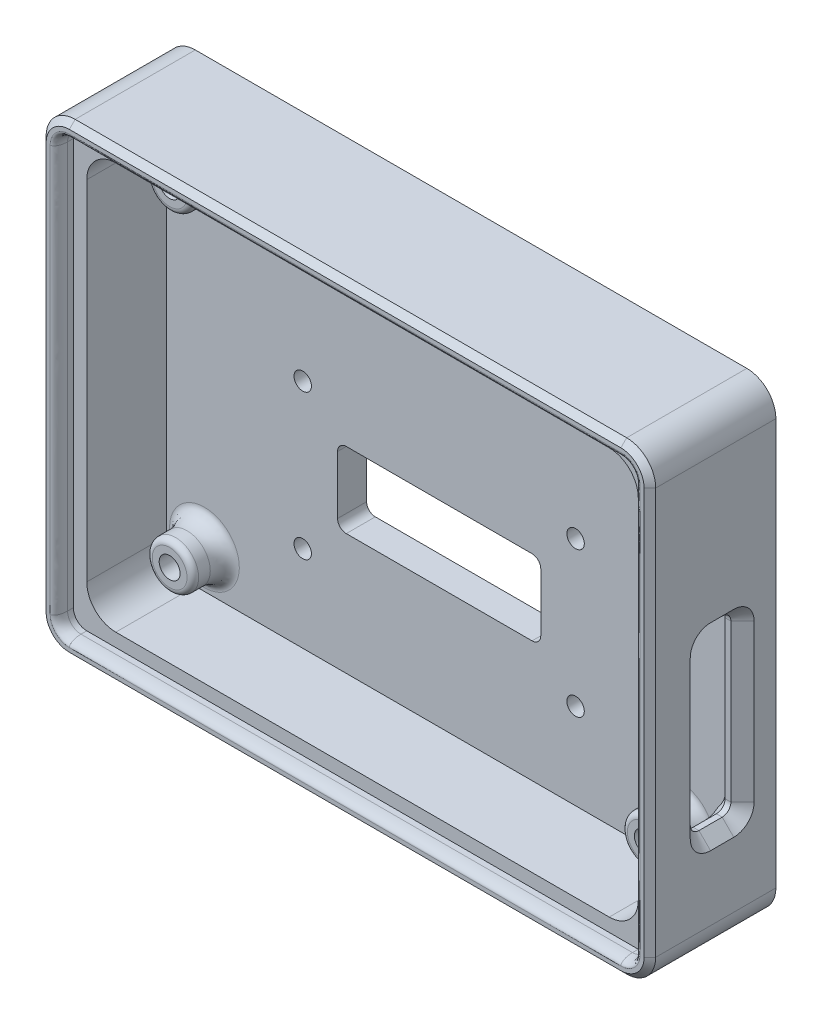
from build123d import *
from build123d.topology import SkipClean

# Parameters (mm, degrees)
SZKIC1_W                       = 105
SZKIC1_H                       = 80
DODANIE_WYCI_GNI_CIE1_DEPTH    = 21.7
SKORUPA2_T                     = -5
OTW_R_GWINTOWANY_M3X0_51_D     = 2.5
OTW_R_GWINTOWANY_M3X0_51_DEPTH = 6
OTW_R_GWINTOWANY_M3X0_51_TIP   = 0.751075774
SZKIC7_W                       = 35
SZKIC7_H                       = 13
WYTNIJ_WYCI_GNI_CIE1_DEPTH     = 69.081862489
ZAOKR_GLENIE1_R                = 5
WYTNIJ_WYCI_GNI_CIE2_DEPTH     = 5
WYTNIJ_WYCI_GNI_CIE5_DEPTH     = 3
SFAZOWANIE1_SIZE               = 2
ZAOKR_GLENIE2_R                = 1.5
SZKIC14_R                      = 4
SZKIC14_R_2                    = 1.25
DODANIE_WYCI_GNI_CIE2_DEPTH    = 6
ZAOKR_GLENIE3_R                = 1
ZAOKR_GLENIE4_SIZE             = 2
ZAOKR_GLENIE4_SIZE_2           = 1
SFAZOWANIE2_SIZE               = 1
SZKIC16_R                      = 1.8
WYTNIJ_WYCI_GNI_CIE6_DEPTH     = 70.477622328
SZKIC17_R                      = 3.5
SZKIC17_R_2                    = 3.8
WYTNIJ_WYCI_GNI_CIE7_DEPTH     = 3.5
ZAOKR_GLENIE5_SIZE             = 2
ZAOKR_GLENIE5_SIZE_2           = 3
SZKIC20_R                      = 1.5
WYTNIJ_WYCI_GNI_CIE8_DEPTH     = 69.081862514


with BuildPart() as part:
    # Szkic1 → Dodanie-wyciągnięcie1 (new body)
    with BuildSketch(Plane.XY):
        Rectangle(SZKIC1_W, SZKIC1_H)
    extrude(amount=DODANIE_WYCI_GNI_CIE1_DEPTH)

    # Skorupa2
    skorupa2_openings = [part.faces().sort_by_distance(p)[0] for p in [
        (0, 0, 21.7),
    ]]
    offset(amount=SKORUPA2_T, openings=skorupa2_openings, kind=Kind.INTERSECTION)

    # Otwór gwintowany M3x0.51
    with Locations(Plane.XY.offset(5)):
        with Locations((-40.925, 28.425), (40.925, 28.425), (40.925, -28.425), (-40.925, -28.425)):
            Hole(OTW_R_GWINTOWANY_M3X0_51_D / 2, depth=OTW_R_GWINTOWANY_M3X0_51_DEPTH)
            with Locations((0, 0, -(OTW_R_GWINTOWANY_M3X0_51_DEPTH + OTW_R_GWINTOWANY_M3X0_51_TIP / 2))):  # 118° drill point
                Cone(0, OTW_R_GWINTOWANY_M3X0_51_D / 2, OTW_R_GWINTOWANY_M3X0_51_TIP, mode=Mode.SUBTRACT)

    # Szkic7 → Wytnij-wyciągnięcie1 (cut, through all)
    with BuildSketch(Plane.XY.offset(5)):
        with Locations((-0.5, -7.645)):
            Rectangle(SZKIC7_W, SZKIC7_H)
    extrude(amount=-WYTNIJ_WYCI_GNI_CIE1_DEPTH, mode=Mode.SUBTRACT)

    # Zaokrąglenie1
    zaokr_glenie1_edges = [part.edges().sort_by_distance(p)[0] for p in [
        (47.5, -35, 13.35),
        (47.5, 35, 13.35),
        (-47.5, 35, 13.35),
        (-47.5, -35, 13.35),
        (52.5, -40, 10.85),
        (-52.5, -40, 10.85),
        (-52.5, 40, 10.85),
        (52.5, 40, 10.85),
    ]]
    fillet(zaokr_glenie1_edges, radius=ZAOKR_GLENIE1_R)

    # Szkic8 → Wytnij-wyciągnięcie2 (cut)
    with BuildSketch(Plane(origin=(52.5, 0, 0), x_dir=(0, 0, -1), z_dir=(1, 0, 0))):
        with BuildLine():
            Line((-11.25, -21.82), (-7.25, -21.82))
            ThreePointArc((-7.25, -21.82), (-6.189339828, -21.380660172), (-5.75, -20.32))
            Line((-5.75, -20.32), (-5.75, 6.68))
            ThreePointArc((-5.75, 6.68), (-6.189339828, 7.740660172), (-7.25, 8.18))
            Line((-7.25, 8.18), (-11.25, 8.18))
            ThreePointArc((-11.25, 8.18), (-12.310660172, 7.740660172), (-12.75, 6.68))
            Line((-12.75, 6.68), (-12.75, -20.32))
            ThreePointArc((-12.75, -20.32), (-12.310660172, -21.380660172), (-11.25, -21.82))
        make_face()
    extrude(amount=-WYTNIJ_WYCI_GNI_CIE2_DEPTH, mode=Mode.SUBTRACT)

    # Szkic13 → Wytnij-wyciągnięcie5 (cut)
    with BuildSketch(Plane.XY.offset(21.7)):
        with BuildLine():
            Line((47.5, 37.3), (-47.5, 37.3))
            ThreePointArc((-47.5, 37.3), (-49.126345597, 36.626345597), (-49.8, 35))
            Line((-49.8, 35), (-49.8, -35))
            ThreePointArc((-49.8, -35), (-49.126345597, -36.626345597), (-47.5, -37.3))
            Line((-47.5, -37.3), (47.5, -37.3))
            ThreePointArc((47.5, -37.3), (49.126345597, -36.626345597), (49.8, -35))
            Line((49.8, -35), (49.8, 35))
            ThreePointArc((49.8, 35), (49.126345597, 36.626345597), (47.5, 37.3))
        make_face()
    extrude(amount=-WYTNIJ_WYCI_GNI_CIE5_DEPTH, mode=Mode.SUBTRACT)

    # Sfazowanie1
    # the kernel refuses this chamfer: 2 mm, written as the material it takes off along each edge
    with BuildSketch(Plane(origin=(47.5, -20.32, 11.25), x_dir=(0, 0, 1), z_dir=(0, 1, 0))) as sfazowanie1_piece_1:
        Polygon((1.5, SFAZOWANIE1_SIZE), (1.5 + SFAZOWANIE1_SIZE, 0), (1.5, 0), align=None)
    revolve(axis=Axis((47.5, -20.32, 11.25), (1, 0, 0)), revolution_arc=90, mode=Mode.SUBTRACT)
    with BuildSketch(Plane(origin=(47.5, 6.68, 12.75), x_dir=(0.9996219169112968, 0, -0.02749587661058651), z_dir=(0, -1, 0)), Plane(origin=(52.5, -20.32, 5.75), x_dir=(0.02749587661058563, 0, -0.9996219169112968), z_dir=(0, 1, 0)), Plane(origin=(52.5, 6.68, 12.75), x_dir=(0.027495876610585623, 0, 0.9996219169112968), z_dir=(0, -1, 0))) as sfazowanie1_piece_2:
        Polygon((SFAZOWANIE1_SIZE * 0.999621916911, SFAZOWANIE1_SIZE * 0.0274958766106), (-SFAZOWANIE1_SIZE * 0.0274958766106, SFAZOWANIE1_SIZE * 0.999621916911), (0, 0), align=None)
    extrude(amount=27, mode=Mode.SUBTRACT)
    with BuildSketch(Plane(origin=(47.5, 6.68, 11.25), x_dir=(0, 1, 0), z_dir=(0, 0, -1))) as sfazowanie1_piece_3:
        Polygon((1.5, SFAZOWANIE1_SIZE), (1.5 + SFAZOWANIE1_SIZE, 0), (1.5, 0), align=None)
    revolve(axis=Axis((47.5, 6.68, 11.25), (1, 0, 0)), revolution_arc=90, mode=Mode.SUBTRACT)
    with BuildSketch(Plane(origin=(47.5, 8.18, 7.25), x_dir=(0.9996219169112968, -0.027495876610585647, 0), z_dir=(0, 0, 1)), Plane(origin=(52.5, -21.82, 11.25), x_dir=(0.027495876610585696, -0.9996219169112968, 0), z_dir=(0, 0, -1)), Plane(origin=(47.5, -21.82, 11.25), x_dir=(0.9996219169112968, 0.027495876610585647, 0), z_dir=(0, 0, -1)), Plane(origin=(52.5, 8.18, 7.25), x_dir=(0.027495876610585574, 0.9996219169112968, 0), z_dir=(0, 0, 1))) as sfazowanie1_piece_4:
        Polygon((SFAZOWANIE1_SIZE * 0.999621916911, SFAZOWANIE1_SIZE * 0.0274958766106), (-SFAZOWANIE1_SIZE * 0.0274958766106, SFAZOWANIE1_SIZE * 0.999621916911), (0, 0), align=None)
    extrude(amount=4, mode=Mode.SUBTRACT)
    with BuildSketch(Plane(origin=(47.5, 6.68, 7.25), x_dir=(0, 0, -1), z_dir=(0, -1, 0))) as sfazowanie1_piece_5_section:
        Polygon((1.5, SFAZOWANIE1_SIZE), (1.5 + SFAZOWANIE1_SIZE, 0), (1.5, 0), align=None)
    sfazowanie1_piece_5 = revolve(axis=Axis((47.5, 6.68, 7.25), (1, 0, 0)), revolution_arc=90, mode=Mode.PRIVATE)
    sfazowanie1_piece_5 = split(sfazowanie1_piece_5, bisect_by=Plane(origin=(48.157574001, 8.247961996, 5), z_dir=(0, 0, 1)), keep=Keep.TOP, mode=Mode.PRIVATE)
    add(sfazowanie1_piece_5, mode=Mode.SUBTRACT)
    with BuildSketch(Plane(origin=(52.5, -20.32, 7.25), x_dir=(0, -1, 0), z_dir=(0, 0, 1))) as sfazowanie1_piece_6:
        Polygon((1.5 + SFAZOWANIE1_SIZE, 0), (1.5, -SFAZOWANIE1_SIZE), (1.5, 0), align=None)
    revolve(axis=Axis((52.5, -20.32, 7.25), (1, 0, 0)), revolution_arc=90, mode=Mode.SUBTRACT)
    with BuildSketch(Plane(origin=(47.5, -20.32, 7.25), x_dir=(0, -1, 0), z_dir=(0, 0, 1))) as sfazowanie1_piece_7_section:
        Polygon((1.5, SFAZOWANIE1_SIZE), (1.5 + SFAZOWANIE1_SIZE, 0), (1.5, 0), align=None)
    sfazowanie1_piece_7 = revolve(axis=Axis((47.5, -20.32, 7.25), (1, 0, 0)), revolution_arc=90, mode=Mode.PRIVATE)
    sfazowanie1_piece_7 = split(sfazowanie1_piece_7, bisect_by=Plane(origin=(48.157574012, -21.887961994, 5), z_dir=(0, 0, 1)), keep=Keep.TOP, mode=Mode.PRIVATE)
    add(sfazowanie1_piece_7, mode=Mode.SUBTRACT)
    with BuildSketch(Plane(origin=(47.5, -20.32, 5.75), x_dir=(0.9996219169112968, 0, 0.02749587661058651), z_dir=(0, 1, 0))) as sfazowanie1_piece_8_section:
        Polygon((SFAZOWANIE1_SIZE * 0.999621916911, SFAZOWANIE1_SIZE * 0.0274958766106), (-SFAZOWANIE1_SIZE * 0.0274958766106, SFAZOWANIE1_SIZE * 0.999621916911), (0, 0), align=None)
    sfazowanie1_piece_8 = extrude(amount=27, mode=Mode.PRIVATE)
    sfazowanie1_piece_8 = split(sfazowanie1_piece_8, bisect_by=Plane(origin=(48.338667928, -6.82, 5), z_dir=(0, 0, 1)), keep=Keep.TOP, mode=Mode.PRIVATE)
    add(sfazowanie1_piece_8, mode=Mode.SUBTRACT)
    with BuildSketch(Plane(origin=(52.5, 6.68, 7.25), x_dir=(0, 0, -1), z_dir=(0, -1, 0))) as sfazowanie1_piece_9:
        Polygon((1.5 + SFAZOWANIE1_SIZE, 0), (1.5, -SFAZOWANIE1_SIZE), (1.5, 0), align=None)
    revolve(axis=Axis((52.5, 6.68, 7.25), (1, 0, 0)), revolution_arc=90, mode=Mode.SUBTRACT)
    with BuildSketch(Plane(origin=(52.5, 6.68, 11.25), x_dir=(0, 1, 0), z_dir=(0, 0, -1))) as sfazowanie1_piece_10:
        Polygon((1.5 + SFAZOWANIE1_SIZE, 0), (1.5, -SFAZOWANIE1_SIZE), (1.5, 0), align=None)
    revolve(axis=Axis((52.5, 6.68, 11.25), (1, 0, 0)), revolution_arc=90, mode=Mode.SUBTRACT)
    with BuildSketch(Plane(origin=(52.5, -20.32, 11.25), x_dir=(0, 0, 1), z_dir=(0, 1, 0))) as sfazowanie1_piece_11:
        Polygon((1.5 + SFAZOWANIE1_SIZE, 0), (1.5, -SFAZOWANIE1_SIZE), (1.5, 0), align=None)
    revolve(axis=Axis((52.5, -20.32, 11.25), (1, 0, 0)), revolution_arc=90, mode=Mode.SUBTRACT)

    # Zaokrąglenie2
    zaokr_glenie2_edges = [part.edges().sort_by_distance(p)[0] for p in [
        (17, -1.145, 2.5),
        (17, -14.145, 2.5),
        (-18, -14.145, 2.5),
        (-18, -1.145, 2.5),
    ]]
    fillet(zaokr_glenie2_edges, radius=ZAOKR_GLENIE2_R)

    # Szkic14 → Dodanie-wyciągnięcie2 (add)
    # profile 1 of 4: a face of its own
    with SkipClean():  # the faces are left unmerged after this step: merging them gives an invalid solid
        with BuildSketch(Plane.XY.offset(5)):
            with Locations((-40.925, 28.425)):
                Circle(SZKIC14_R)
            with Locations((-40.925, 28.425)):
                Circle(SZKIC14_R_2, mode=Mode.SUBTRACT)
        # profile 2 of 4: a face of its own
        with BuildSketch(Plane.XY.offset(5)):
            with Locations((40.925, 28.425)):
                Circle(SZKIC14_R)
            with Locations((40.925, 28.425)):
                Circle(SZKIC14_R_2, mode=Mode.SUBTRACT)
        # profile 3 of 4: a face of its own
        with BuildSketch(Plane.XY.offset(5)):
            with Locations((-40.925, -28.425)):
                Circle(SZKIC14_R)
            with Locations((-40.925, -28.425)):
                Circle(SZKIC14_R_2, mode=Mode.SUBTRACT)
        # profile 4 of 4: a face of its own
        with BuildSketch(Plane.XY.offset(5)):
            with Locations((40.925, -28.425)):
                Circle(SZKIC14_R)
            with Locations((40.925, -28.425)):
                Circle(SZKIC14_R_2, mode=Mode.SUBTRACT)
        extrude(amount=DODANIE_WYCI_GNI_CIE2_DEPTH)
    add(part.part.scale(1), mode=Mode.REPLACE)  # the faces are merged on a copy

    # Zaokrąglenie3
    zaokr_glenie3_edges = [part.edges().sort_by_distance(p)[0] for p in [
        (-44.925, 28.425, 11),
        (36.925, 28.425, 11),
        (-44.925, -28.425, 11),
        (36.925, -28.425, 11),
    ]]
    fillet(zaokr_glenie3_edges, radius=ZAOKR_GLENIE3_R)

    # Zaokrąglenie4
    # an asymmetric fillet: 2, 1 mm, written as the material it takes off along each edge
    with BuildSketch(Plane(origin=(49.8, -35, 21.7), x_dir=(0, 0, -1), z_dir=(0, 1, 0)), Plane(origin=(-49.8, 35, 21.7), x_dir=(0, 0, -1), z_dir=(0, -1, 0))) as zaokr_glenie4_piece_1:
        with BuildLine():
            Bezier((ZAOKR_GLENIE4_SIZE, 0), (0, 0), (0, -ZAOKR_GLENIE4_SIZE_2), weights=[1, 0.707106781, 1])
            Line((0, -ZAOKR_GLENIE4_SIZE_2), (0, 0))
            Line((0, 0), (ZAOKR_GLENIE4_SIZE, 0))
        make_face()
    extrude(amount=70, mode=Mode.SUBTRACT)
    with BuildSketch(Plane(origin=(47.5, 35, 21.7), x_dir=(1, 0, 0), z_dir=(0, -1, 0))) as zaokr_glenie4_piece_2:
        with BuildLine():
            Bezier((2.3, -ZAOKR_GLENIE4_SIZE), (2.3, 0), (2.3 + ZAOKR_GLENIE4_SIZE_2, 0), weights=[1, 0.707106781, 1])
            Line((2.3 + ZAOKR_GLENIE4_SIZE_2, 0), (2.3, 0))
            Line((2.3, 0), (2.3, -ZAOKR_GLENIE4_SIZE))
        make_face()
    revolve(axis=Axis((47.5, 35, 21.7), (0, 0, 1)), revolution_arc=90, mode=Mode.SUBTRACT)
    with BuildSketch(Plane(origin=(47.5, 37.3, 21.7), x_dir=(0, 0, -1), z_dir=(-1, 0, 0)), Plane(origin=(-47.5, -37.3, 21.7), x_dir=(0, 0, -1), z_dir=(1, 0, 0))) as zaokr_glenie4_piece_3:
        with BuildLine():
            Bezier((ZAOKR_GLENIE4_SIZE, 0), (0, 0), (0, -ZAOKR_GLENIE4_SIZE_2), weights=[1, 0.707106781, 1])
            Line((0, -ZAOKR_GLENIE4_SIZE_2), (0, 0))
            Line((0, 0), (ZAOKR_GLENIE4_SIZE, 0))
        make_face()
    extrude(amount=95, mode=Mode.SUBTRACT)
    with BuildSketch(Plane(origin=(-47.5, 35, 21.7), x_dir=(0, 1, 0), z_dir=(1, 0, 0))) as zaokr_glenie4_piece_4:
        with BuildLine():
            Bezier((2.3, -ZAOKR_GLENIE4_SIZE), (2.3, 0), (2.3 + ZAOKR_GLENIE4_SIZE_2, 0), weights=[1, 0.707106781, 1])
            Line((2.3 + ZAOKR_GLENIE4_SIZE_2, 0), (2.3, 0))
            Line((2.3, 0), (2.3, -ZAOKR_GLENIE4_SIZE))
        make_face()
    revolve(axis=Axis((-47.5, 35, 21.7), (0, 0, 1)), revolution_arc=90, mode=Mode.SUBTRACT)
    with BuildSketch(Plane(origin=(-47.5, -35, 21.7), x_dir=(-1, 0, 0), z_dir=(0, 1, 0))) as zaokr_glenie4_piece_5:
        with BuildLine():
            Bezier((2.3, -ZAOKR_GLENIE4_SIZE), (2.3, 0), (2.3 + ZAOKR_GLENIE4_SIZE_2, 0), weights=[1, 0.707106781, 1])
            Line((2.3 + ZAOKR_GLENIE4_SIZE_2, 0), (2.3, 0))
            Line((2.3, 0), (2.3, -ZAOKR_GLENIE4_SIZE))
        make_face()
    revolve(axis=Axis((-47.5, -35, 21.7), (0, 0, 1)), revolution_arc=90, mode=Mode.SUBTRACT)
    with BuildSketch(Plane(origin=(47.5, -35, 21.7), x_dir=(0, -1, 0), z_dir=(-1, 0, 0))) as zaokr_glenie4_piece_6:
        with BuildLine():
            Bezier((2.3, -ZAOKR_GLENIE4_SIZE), (2.3, 0), (2.3 + ZAOKR_GLENIE4_SIZE_2, 0), weights=[1, 0.707106781, 1])
            Line((2.3 + ZAOKR_GLENIE4_SIZE_2, 0), (2.3, 0))
            Line((2.3, 0), (2.3, -ZAOKR_GLENIE4_SIZE))
        make_face()
    revolve(axis=Axis((47.5, -35, 21.7), (0, 0, 1)), revolution_arc=90, mode=Mode.SUBTRACT)

    # Sfazowanie2
    sfazowanie2_edges = [part.edges().sort_by_distance(p)[0] for p in [
        (-52.5, 0, 21.7),
        (0, 40, 21.7),
        (52.5, 0, 21.7),
        (0, -40, 21.7),
        (51.035533906, 38.535533906, 21.7),
        (51.035533906, -38.535533906, 21.7),
        (-51.035533906, -38.535533906, 21.7),
        (-51.035533906, 38.535533906, 21.7),
    ]]
    chamfer(sfazowanie2_edges, length=SFAZOWANIE2_SIZE)

    # Szkic16 → Wytnij-wyciągnięcie6 (cut, through all)
    with BuildSketch(Plane(origin=(0, 0, 0), x_dir=(-1, 0, 0), z_dir=(0, 0, -1))):
        with Locations((40.925, -28.425)):
            Circle(SZKIC16_R)
        with Locations((-40.925, -28.425)):
            Circle(SZKIC16_R)
        with Locations((-40.925, 28.425)):
            Circle(SZKIC16_R)
        with Locations((40.925, 28.425)):
            Circle(SZKIC16_R)
    extrude(amount=-WYTNIJ_WYCI_GNI_CIE6_DEPTH, mode=Mode.SUBTRACT)

    # Szkic17 → Wytnij-wyciągnięcie7 (cut)
    with BuildSketch(Plane(origin=(0, 0, 0), x_dir=(-1, 0, 0), z_dir=(0, 0, -1))):
        with Locations((40.925, -28.425)):
            Circle(SZKIC17_R)
        with Locations((-40.925, -28.425)):
            Circle(SZKIC17_R_2)
        with Locations((-40.925, 28.425)):
            Circle(SZKIC17_R_2)
        with Locations((40.925, 28.425)):
            Circle(SZKIC17_R)
    extrude(amount=-WYTNIJ_WYCI_GNI_CIE7_DEPTH, mode=Mode.SUBTRACT)

    # Zaokrąglenie5
    # an asymmetric fillet: 3, 2 mm, written as the material it adds along each edge
    with BuildSketch(Plane(origin=(-40.925, 28.425, 5), x_dir=(1, 0, 0), z_dir=(0, -1, 0))) as zaokr_glenie5_piece_1:
        with BuildLine():
            Bezier((4 + ZAOKR_GLENIE5_SIZE, 0), (4, 0), (4, ZAOKR_GLENIE5_SIZE_2), weights=[1, 0.707106781, 1])
            Line((4, ZAOKR_GLENIE5_SIZE_2), (4, 0))
            Line((4, 0), (4 + ZAOKR_GLENIE5_SIZE, 0))
        make_face()
    revolve(axis=Axis((-40.925, 28.425, 5), (0, 0, 1)))
    with BuildSketch(Plane(origin=(40.925, 28.425, 5), x_dir=(1, 0, 0), z_dir=(0, -1, 0))) as zaokr_glenie5_piece_2:
        with BuildLine():
            Bezier((4 + ZAOKR_GLENIE5_SIZE, 0), (4, 0), (4, ZAOKR_GLENIE5_SIZE_2), weights=[1, 0.707106781, 1])
            Line((4, ZAOKR_GLENIE5_SIZE_2), (4, 0))
            Line((4, 0), (4 + ZAOKR_GLENIE5_SIZE, 0))
        make_face()
    revolve(axis=Axis((40.925, 28.425, 5), (0, 0, 1)))
    with BuildSketch(Plane(origin=(-40.925, -28.425, 5), x_dir=(1, 0, 0), z_dir=(0, -1, 0))) as zaokr_glenie5_piece_3:
        with BuildLine():
            Bezier((4 + ZAOKR_GLENIE5_SIZE, 0), (4, 0), (4, ZAOKR_GLENIE5_SIZE_2), weights=[1, 0.707106781, 1])
            Line((4, ZAOKR_GLENIE5_SIZE_2), (4, 0))
            Line((4, 0), (4 + ZAOKR_GLENIE5_SIZE, 0))
        make_face()
    revolve(axis=Axis((-40.925, -28.425, 5), (0, 0, 1)))
    with BuildSketch(Plane(origin=(40.925, -28.425, 5), x_dir=(1, 0, 0), z_dir=(0, -1, 0))) as zaokr_glenie5_piece_4:
        with BuildLine():
            Bezier((4 + ZAOKR_GLENIE5_SIZE, 0), (4, 0), (4, ZAOKR_GLENIE5_SIZE_2), weights=[1, 0.707106781, 1])
            Line((4, ZAOKR_GLENIE5_SIZE_2), (4, 0))
            Line((4, 0), (4 + ZAOKR_GLENIE5_SIZE, 0))
        make_face()
    revolve(axis=Axis((40.925, -28.425, 5), (0, 0, 1)))

    # Szkic20 → Wytnij-wyciągnięcie8 (cut, through all)
    with BuildSketch(Plane.XY.offset(5)):
        with Locations((-24, 4.855)):
            Circle(SZKIC20_R)
        with Locations(Location((-24, -20.145, 0), (0, 0, 180))):
            Circle(SZKIC20_R)
        with Locations((23, -20.145)):
            Circle(SZKIC20_R)
        with Locations(Location((23, 4.855, 0), (0, 0, 180))):
            Circle(SZKIC20_R)
    extrude(amount=-WYTNIJ_WYCI_GNI_CIE8_DEPTH, mode=Mode.SUBTRACT)


solid = part.part
